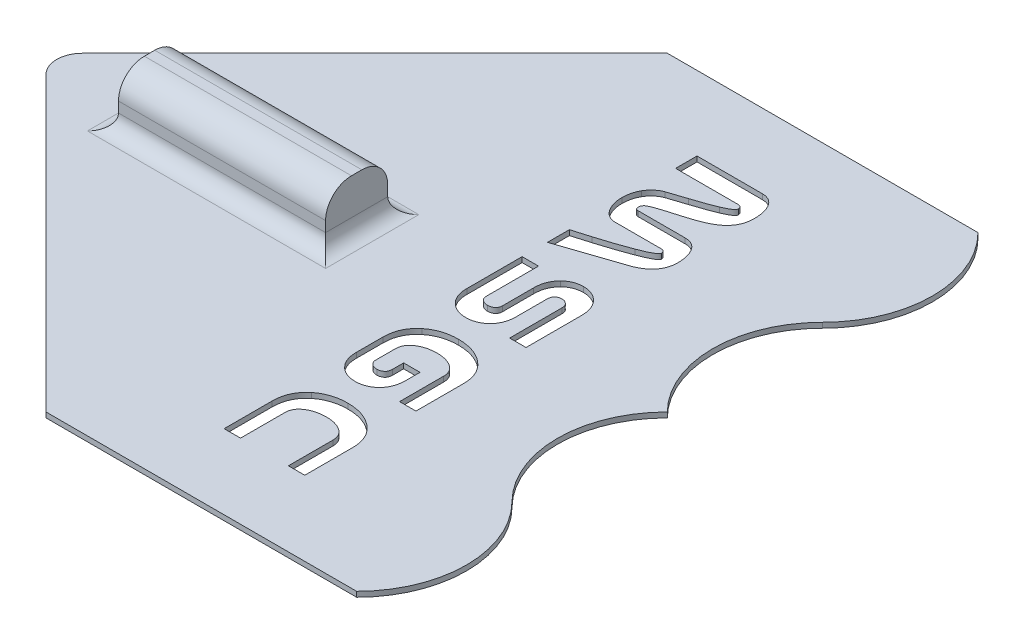
from build123d import *

# Parameters (mm, degrees)
BOSS_EXTRUDE1_DEPTH = 1
SKETCH2_W           = 40
SKETCH2_H           = 12
BOSS_EXTRUDE2_DEPTH = 10
CUT_EXTRUDE1_DEPTH  = 35
FILLET1_R           = 5
FILLET2_R           = 3
CUT_EXTRUDE3_DEPTH  = 10.5
FILLET3_R           = 5


with BuildPart() as part:
    # Sketch1 → Boss-Extrude1 (new body)
    with BuildSketch(Plane(origin=(0, 0, 0), x_dir=(1, 0, 0), z_dir=(0, 1, 0))):
        with BuildLine():
            Line((0, 0), (60, 60))
            Line((60, 60), (120, 60))
            ThreePointArc((120, 60), (126.213203436, 45), (120, 30))
            ThreePointArc((120, 30), (113.786796564, 15), (120, 0))
            ThreePointArc((120, 0), (113.786796564, -15), (120, -30))
            ThreePointArc((120, -30), (126.213203436, -45), (120, -60))
            Line((120, -60), (60, -60))
            Line((60, -60), (0, 0))
        make_face()
    extrude(amount=BOSS_EXTRUDE1_DEPTH)

    # Sketch2 → Boss-Extrude2 (add)
    with BuildSketch(Plane(origin=(0, 1, 0), x_dir=(1, 0, 0), z_dir=(0, 1, 0))):
        with Locations((40, 0)):
            Rectangle(SKETCH2_W, SKETCH2_H)
    extrude(amount=BOSS_EXTRUDE2_DEPTH)

    # Sketch3 → Cut-Extrude1 (cut)
    with BuildSketch(Plane.ZY.offset(-20)):
        Polygon((0, 1.110912703), (3.889087297, 5), (0, 8.889087297), (-3.889087297, 5), align=None)
    extrude(amount=-CUT_EXTRUDE1_DEPTH, mode=Mode.SUBTRACT)

    # Fillet1
    fillet1_edges = [part.edges().sort_by_distance(p)[0] for p in [
        (40, 11, -6),
        (40, 11, 6),
    ]]
    fillet(fillet1_edges, radius=FILLET1_R)

    # Fillet2
    # the kernel refuses this fillet: 3 mm, written as the material it adds along each edge
    with BuildSketch(Plane(origin=(20, 1, 6), x_dir=(0, 0, 1), z_dir=(1, 0, 0))) as fillet2_piece_1:
        with BuildLine():
            CenterArc((FILLET2_R, -FILLET2_R), FILLET2_R, 90, 90)
            Line((0, -FILLET2_R), (0, 0))
            Line((0, 0), (FILLET2_R, 0))
        make_face()
    extrude(amount=40)
    with BuildSketch(Plane(origin=(60, 1, 6), x_dir=(1, 0, 0), z_dir=(0, 0, -1))) as fillet2_piece_2:
        with BuildLine():
            CenterArc((FILLET2_R, -FILLET2_R), FILLET2_R, 90, 90)
            Line((0, -FILLET2_R), (0, 0))
            Line((0, 0), (FILLET2_R, 0))
        make_face()
    extrude(amount=12)
    with BuildSketch(Plane(origin=(20, 1, -6), x_dir=(0, 1, 0), z_dir=(0, 0, 1))) as fillet2_piece_3_section:
        with BuildLine():
            CenterArc((FILLET2_R, FILLET2_R), FILLET2_R, 180, 90)
            Line((0, FILLET2_R), (0, 0))
            Line((0, 0), (FILLET2_R, 0))
        make_face()
    fillet2_piece_3 = extrude(amount=12, mode=Mode.PRIVATE)
    fillet2_piece_3 = split(fillet2_piece_3, bisect_by=Plane(origin=(19.279830893, 2.992442475, -1.881529772), z_dir=(0, -0.7071067811865477, -0.7071067811865475)), keep=Keep.TOP, mode=Mode.PRIVATE)
    fillet2_piece_3 = split(fillet2_piece_3, bisect_by=Plane(origin=(19.279830893, -0.275222793, -1.386135496), z_dir=(0, 0.7071067811865475, -0.7071067811865477)), keep=Keep.TOP, mode=Mode.PRIVATE)
    add(fillet2_piece_3)
    with BuildSketch(Plane(origin=(20, 1, -6), x_dir=(0, 1, 0), z_dir=(0, 0, 1))) as fillet2_piece_4_section:
        with BuildLine():
            CenterArc((FILLET2_R, FILLET2_R), FILLET2_R, 180, 90)
            Line((0, FILLET2_R), (0, 0))
            Line((0, 0), (FILLET2_R, 0))
        make_face()
    fillet2_piece_4 = extrude(amount=12, mode=Mode.PRIVATE)
    fillet2_piece_4 = split(fillet2_piece_4, bisect_by=Plane(origin=(18.610952236, 1.052340199, 0.058572505), z_dir=(0, -0.7071067811865477, -0.7071067811865475)), keep=Keep.TOP, mode=Mode.PRIVATE)
    fillet2_piece_4 = split(fillet2_piece_4, bisect_by=Plane(origin=(18.610952236, 1.052340199, -0.058572505), z_dir=(0, -0.7071067811865475, 0.7071067811865477)), keep=Keep.TOP, mode=Mode.PRIVATE)
    add(fillet2_piece_4)
    with BuildSketch(Plane(origin=(20, 1, -6), x_dir=(0, 1, 0), z_dir=(0, 0, 1))) as fillet2_piece_5_section:
        with BuildLine():
            CenterArc((FILLET2_R, FILLET2_R), FILLET2_R, 180, 90)
            Line((0, FILLET2_R), (0, 0))
            Line((0, 0), (FILLET2_R, 0))
        make_face()
    fillet2_piece_5 = extrude(amount=12, mode=Mode.PRIVATE)
    fillet2_piece_5 = split(fillet2_piece_5, bisect_by=Plane(origin=(19.279830893, -0.275222793, 1.386135496), z_dir=(0, 0.7071067811865477, 0.7071067811865475)), keep=Keep.TOP, mode=Mode.PRIVATE)
    fillet2_piece_5 = split(fillet2_piece_5, bisect_by=Plane(origin=(19.279830893, 2.992442475, 1.881529772), z_dir=(0, -0.7071067811865475, 0.7071067811865477)), keep=Keep.TOP, mode=Mode.PRIVATE)
    add(fillet2_piece_5)
    with BuildSketch(Plane(origin=(60, 1, -6), x_dir=(0, 1, 0), z_dir=(-1, 0, 0))) as fillet2_piece_6:
        with BuildLine():
            CenterArc((FILLET2_R, FILLET2_R), FILLET2_R, 180, 90)
            Line((0, FILLET2_R), (0, 0))
            Line((0, 0), (FILLET2_R, 0))
        make_face()
    extrude(amount=40)
    with BuildSketch(Plane(origin=(20, 1, -6), x_dir=(0, 1, 0), z_dir=(0, 0, 1))) as fillet2_piece_7a_section:
        with BuildLine():
            CenterArc((FILLET2_R, FILLET2_R), FILLET2_R, 180, 90)
            Line((0, FILLET2_R), (0, 0))
            Line((0, 0), (FILLET2_R, 0))
        make_face()
    fillet2_piece_7a = extrude(amount=19.5, mode=Mode.PRIVATE)
    fillet2_piece_7a = split(fillet2_piece_7a, bisect_by=Plane(origin=(19.320814657, 1.679185343, 6), z_dir=(0, 0, 1)), keep=Keep.TOP, mode=Mode.PRIVATE)
    with BuildSketch(Plane(origin=(12.5, 1, 6), x_dir=(0, 0, 1), z_dir=(1, 0, 0))) as fillet2_piece_7b_section:
        with BuildLine():
            CenterArc((FILLET2_R, -FILLET2_R), FILLET2_R, 90, 90)
            Line((0, -FILLET2_R), (0, 0))
            Line((0, 0), (FILLET2_R, 0))
        make_face()
    fillet2_piece_7b = extrude(amount=47.5, mode=Mode.PRIVATE)
    fillet2_piece_7b = split(fillet2_piece_7b, bisect_by=Plane(origin=(20, 1.679185343, 6.679185343), z_dir=(-1, 0, 0)), keep=Keep.TOP, mode=Mode.PRIVATE)
    fillet2_piece_7 = fillet2_piece_7a & fillet2_piece_7b
    add(fillet2_piece_7)
    with BuildSketch(Plane(origin=(60, 1, 13.5), x_dir=(1, 0, 0), z_dir=(0, 0, -1))) as fillet2_piece_8a_section:
        with BuildLine():
            CenterArc((FILLET2_R, -FILLET2_R), FILLET2_R, 90, 90)
            Line((0, -FILLET2_R), (0, 0))
            Line((0, 0), (FILLET2_R, 0))
        make_face()
    fillet2_piece_8a = extrude(amount=19.5, mode=Mode.PRIVATE)
    fillet2_piece_8a = split(fillet2_piece_8a, bisect_by=Plane(origin=(60.679185343, 1.679185343, 6), z_dir=(0, 0, 1)), keep=Keep.TOP, mode=Mode.PRIVATE)
    with BuildSketch(Plane(origin=(20, 1, 6), x_dir=(0, 0, 1), z_dir=(1, 0, 0))) as fillet2_piece_8b_section:
        with BuildLine():
            CenterArc((FILLET2_R, -FILLET2_R), FILLET2_R, 90, 90)
            Line((0, -FILLET2_R), (0, 0))
            Line((0, 0), (FILLET2_R, 0))
        make_face()
    fillet2_piece_8b = extrude(amount=47.5, mode=Mode.PRIVATE)
    fillet2_piece_8b = split(fillet2_piece_8b, bisect_by=Plane(origin=(60, 1.679185343, 6.679185343), z_dir=(1, 0, 0)), keep=Keep.TOP, mode=Mode.PRIVATE)
    fillet2_piece_8 = fillet2_piece_8a & fillet2_piece_8b
    add(fillet2_piece_8)
    with BuildSketch(Plane(origin=(67.5, 1, -6), x_dir=(0, 1, 0), z_dir=(-1, 0, 0))) as fillet2_piece_9a_section:
        with BuildLine():
            CenterArc((FILLET2_R, FILLET2_R), FILLET2_R, 180, 90)
            Line((0, FILLET2_R), (0, 0))
            Line((0, 0), (FILLET2_R, 0))
        make_face()
    fillet2_piece_9a = extrude(amount=47.5, mode=Mode.PRIVATE)
    fillet2_piece_9a = split(fillet2_piece_9a, bisect_by=Plane(origin=(60, 1.679185343, -6.679185343), z_dir=(1, 0, 0)), keep=Keep.TOP, mode=Mode.PRIVATE)
    with BuildSketch(Plane(origin=(60, 1, 6), x_dir=(1, 0, 0), z_dir=(0, 0, -1))) as fillet2_piece_9b_section:
        with BuildLine():
            CenterArc((FILLET2_R, -FILLET2_R), FILLET2_R, 90, 90)
            Line((0, -FILLET2_R), (0, 0))
            Line((0, 0), (FILLET2_R, 0))
        make_face()
    fillet2_piece_9b = extrude(amount=19.5, mode=Mode.PRIVATE)
    fillet2_piece_9b = split(fillet2_piece_9b, bisect_by=Plane(origin=(60.679185343, 1.679185343, -6), z_dir=(0, 0, -1)), keep=Keep.TOP, mode=Mode.PRIVATE)
    fillet2_piece_9 = fillet2_piece_9a & fillet2_piece_9b
    add(fillet2_piece_9)
    with BuildSketch(Plane(origin=(20, 1, -13.5), x_dir=(0, 1, 0), z_dir=(0, 0, 1))) as fillet2_piece_10a_section:
        with BuildLine():
            CenterArc((FILLET2_R, FILLET2_R), FILLET2_R, 180, 90)
            Line((0, FILLET2_R), (0, 0))
            Line((0, 0), (FILLET2_R, 0))
        make_face()
    fillet2_piece_10a = extrude(amount=19.5, mode=Mode.PRIVATE)
    fillet2_piece_10a = split(fillet2_piece_10a, bisect_by=Plane(origin=(19.320814657, 1.679185343, -6), z_dir=(0, 0, -1)), keep=Keep.TOP, mode=Mode.PRIVATE)
    with BuildSketch(Plane(origin=(60, 1, -6), x_dir=(0, 1, 0), z_dir=(-1, 0, 0))) as fillet2_piece_10b_section:
        with BuildLine():
            CenterArc((FILLET2_R, FILLET2_R), FILLET2_R, 180, 90)
            Line((0, FILLET2_R), (0, 0))
            Line((0, 0), (FILLET2_R, 0))
        make_face()
    fillet2_piece_10b = extrude(amount=47.5, mode=Mode.PRIVATE)
    fillet2_piece_10b = split(fillet2_piece_10b, bisect_by=Plane(origin=(20, 1.679185343, -6.679185343), z_dir=(-1, 0, 0)), keep=Keep.TOP, mode=Mode.PRIVATE)
    fillet2_piece_10 = fillet2_piece_10a & fillet2_piece_10b
    add(fillet2_piece_10)

    # Sketch4 → Cut-Extrude3 (cut)
    with BuildSketch(Plane(origin=(0, 1, 0), x_dir=(1, 0, 0), z_dir=(0, 1, 0))):
        with BuildLine():
            Line((80.053235809, 16.783729557), (80.053235809, 21.031186604))
            add(Edge.make_bspline(
                [(80.053235809, 21.031186604), (80.613393213, 21.197523279), (81.733363954, 21.530094457), (82.854367375, 21.859167975), (83.414696892, 22.023654187)],
                knots=[0, 0, 0, 0, 1.000307211, 2, 2, 2, 2], degree=3))
            add(Edge.make_bspline(
                [(83.414696892, 22.023654187), (83.731764482, 22.120650481), (84.350136079, 22.309820724), (85.250563897, 22.596283331), (86.103088806, 22.869033297), (86.904677697, 23.133867718), (87.654959408, 23.395187581), (88.357567572, 23.63901705), (89.009146974, 23.880744981), (89.426623539, 24.038794418), (89.628076315, 24.115060969)],
                knots=[0, 0, 0, 0, 1.21356098, 2.366787608, 3.458327339, 4.489656438, 5.45648934, 6.366171503, 7.211598176, 8, 8, 8, 8], degree=3))
            add(Edge.make_bspline(
                [(89.628076315, 24.115060969), (89.88840437, 24.217819576), (90.376935768, 24.410656288), (91.052385994, 24.697500308), (91.623584261, 24.962595786), (92.084772063, 25.20755176), (92.449303244, 25.425494937), (92.697699025, 25.626620609), (92.870140497, 25.806735202), (92.889965345, 25.9383507), (92.898276011, 25.993524516)],
                knots=[0, 0, 0, 0, 1.740115658, 3.265499514, 4.562941408, 5.652408808, 6.516224318, 7.18830621, 7.659734268, 8, 8, 8, 8], degree=3))
            add(Edge.make_bspline(
                [(92.898276011, 25.993524516), (92.884946427, 26.057453848), (92.860207762, 26.176101691), (92.798174796, 26.334694443), (92.72548903, 26.464091954), (92.59597813, 26.585221845), (92.382836, 26.685877273), (92.194935735, 26.693065151), (92.09213376, 26.696997706)],
                knots=[0, 0, 0, 0, 0.981276588, 1.821172606, 2.557562909, 3.191931761, 4.463679864, 6, 6, 6, 6], degree=3))
            Line((92.09213376, 26.696997706), (83.228371561, 26.696997706))
            add(Edge.make_bspline(
                [(83.228371561, 26.696997706), (83.103843733, 26.701307529), (82.85792794, 26.709818507), (82.496705671, 26.779987744), (82.15239544, 26.898022665), (81.826780277, 27.066483724), (81.511543712, 27.269137513), (81.221398675, 27.53173652), (80.94342914, 27.833756409), (80.779691945, 28.062759202), (80.695868075, 28.179995243)],
                knots=[0, 0, 0, 0, 0.974842056, 1.925104307, 2.870217456, 3.816008348, 4.790850405, 5.796797676, 6.872089227, 8, 8, 8, 8], degree=3))
            add(Edge.make_bspline(
                [(80.695868075, 28.179995243), (80.620171486, 28.297884752), (80.469076719, 28.533199028), (80.281269105, 28.909232071), (80.113923752, 29.297171185), (79.986828377, 29.707251078), (79.885188387, 30.131670674), (79.80630197, 30.571831855), (79.766383864, 31.029894966), (79.759925472, 31.341123652), (79.756636302, 31.49962819)],
                knots=[0, 0, 0, 0, 0.959487051, 1.915191616, 2.87676054, 3.85204348, 4.852835307, 5.866810799, 6.913595738, 8, 8, 8, 8], degree=3))
            add(Edge.make_bspline(
                [(79.756636302, 31.49962819), (79.764124791, 31.771675331), (79.778828897, 32.305856536), (79.932404403, 33.080900817), (80.157303034, 33.821009668), (80.392067317, 34.273447559), (80.509542743, 34.499846284)],
                knots=[0, 0, 0, 0, 1.042757589, 2.047518324, 3.022983328, 4, 4, 4, 4], degree=3))
            add(Edge.make_bspline(
                [(80.509542743, 34.499846284), (80.582677792, 34.620032867), (80.726985871, 34.857181749), (80.969884522, 35.191321305), (81.244034823, 35.490070711), (81.530755391, 35.772485858), (81.850403025, 36.016481574), (82.184491291, 36.245284475), (82.546842358, 36.437924263), (82.800371155, 36.544978783), (82.927969495, 36.598858182)],
                knots=[0, 0, 0, 0, 1.033555521, 2.039383499, 3.028561361, 4.009949086, 4.991734412, 5.978410299, 6.98255546, 8, 8, 8, 8], degree=3))
            add(Edge.make_bspline(
                [(82.927969495, 36.598858182), (82.968443399, 36.614310498), (83.078950103, 36.656500265), (83.290475167, 36.72568018), (83.58860471, 36.824945371), (83.972286557, 36.956728382), (84.447294813, 37.104552081), (85.00795555, 37.289697971), (85.654947069, 37.50229601), (86.116934904, 37.649980172), (86.361679176, 37.728217844)],
                knots=[0, 0, 0, 0, 0.28760656, 0.785257906, 1.477169671, 2.373997714, 3.478475492, 4.779826338, 6.294069669, 8, 8, 8, 8], degree=3))
            add(Edge.make_bspline(
                [(86.361679176, 37.728217844), (86.591259217, 37.802520801), (87.037067184, 37.946805341), (87.685421824, 38.165433973), (88.295900893, 38.372321296), (88.868002494, 38.576198307), (89.403529099, 38.766401792), (89.896914154, 38.959914974), (90.355502742, 39.135557055), (90.644954268, 39.258571056), (90.784053882, 39.317686999)],
                knots=[0, 0, 0, 0, 1.23196185, 2.392274201, 3.493269489, 4.522774996, 5.493080853, 6.394427912, 7.228421907, 8, 8, 8, 8], degree=3))
            add(Edge.make_bspline(
                [(90.784053882, 39.317686999), (90.954262665, 39.394199593), (91.273890376, 39.537879284), (91.717066146, 39.751473862), (92.087358686, 39.960965152), (92.387997402, 40.156414563), (92.62332476, 40.338430383), (92.78650122, 40.511440619), (92.890043809, 40.680315528), (92.895711226, 40.794597163), (92.898276011, 40.846315229)],
                knots=[0, 0, 0, 0, 1.657149667, 3.111889682, 4.366958607, 5.431474911, 6.296314017, 6.997410855, 7.546279055, 8, 8, 8, 8], degree=3))
            add(Edge.make_bspline(
                [(92.898276011, 40.846315229), (92.884537916, 40.906269242), (92.858598564, 41.019470393), (92.800124334, 41.172558263), (92.721753121, 41.293818626), (92.601815457, 41.422037193), (92.387565395, 41.527802354), (92.198706901, 41.537115433), (92.095936318, 41.542183304)],
                knots=[0, 0, 0, 0, 0.939222653, 1.773377314, 2.487687195, 3.131320834, 4.438959131, 6, 6, 6, 6], degree=3))
            Line((92.095936318, 41.542183304), (80.053235809, 41.542183304))
            Line((80.053235809, 41.542183304), (80.053235809, 45.679366175))
            Line((80.053235809, 45.679366175), (92.666319986, 45.679366175))
            add(Edge.make_bspline(
                [(92.666319986, 45.679366175), (92.806144682, 45.675928622), (93.07914356, 45.669217016), (93.47389538, 45.589264484), (93.843070493, 45.466981111), (94.190084386, 45.299986313), (94.507777468, 45.075801248), (94.797379056, 44.802904445), (95.063689373, 44.483907942), (95.21307931, 44.243988159), (95.290084859, 44.120317483)],
                knots=[0, 0, 0, 0, 1.043606644, 2.037575981, 2.996201597, 3.945230365, 4.904464291, 5.889727954, 6.912224887, 8, 8, 8, 8], degree=3))
            add(Edge.make_bspline(
                [(95.290084859, 44.120317483), (95.352982716, 44.004711416), (95.479711934, 43.771783505), (95.634754616, 43.397930317), (95.768468201, 43.003214136), (95.873954296, 42.581944608), (95.956761171, 42.138644505), (96.017242243, 41.671510601), (96.056817791, 41.18162588), (96.060250887, 40.846394837), (96.062004089, 40.675200129)],
                knots=[0, 0, 0, 0, 0.884238256, 1.781599998, 2.716646166, 3.683870324, 4.698325051, 5.746816069, 6.849351298, 8, 8, 8, 8], degree=3))
            add(Edge.make_bspline(
                [(96.062004089, 40.675200129), (96.055093817, 40.446526059), (96.041528785, 39.997633355), (95.923175412, 39.344150862), (95.738524425, 38.725852705), (95.472403794, 38.145727111), (95.130693004, 37.601535286), (94.712632136, 37.093628583), (94.219752335, 36.622153765), (93.845963987, 36.350031965), (93.654985011, 36.210997287)],
                knots=[0, 0, 0, 0, 1.035935017, 2.033565387, 3.000623989, 3.954619206, 4.917623108, 5.905758593, 6.929993187, 8, 8, 8, 8], degree=3))
            add(Edge.make_bspline(
                [(93.654985011, 36.210997287), (93.511691577, 36.116495393), (93.211092911, 35.918250835), (92.713665484, 35.64760951), (92.156890218, 35.376819601), (91.536726715, 35.112767977), (90.855534293, 34.850578417), (90.11148545, 34.593507958), (89.307604522, 34.333241656), (88.746446927, 34.174753037), (88.456888517, 34.0929726)],
                knots=[0, 0, 0, 0, 0.730704929, 1.532861074, 2.409191789, 3.366741913, 4.402255391, 5.516997667, 6.718765965, 8, 8, 8, 8], degree=3))
            add(Edge.make_bspline(
                [(88.456888517, 34.0929726), (88.14378267, 34.003089236), (87.548859176, 33.832304417), (86.701964748, 33.587355017), (85.951614167, 33.353591175), (85.291811895, 33.147765826), (84.728320797, 32.952834924), (84.257365423, 32.779523911), (83.877790565, 32.626589941), (83.661382227, 32.519769657), (83.566799204, 32.473082983)],
                knots=[0, 0, 0, 0, 1.516031487, 2.880568209, 4.102725104, 5.173568294, 6.096988055, 6.877162184, 7.509254603, 8, 8, 8, 8], degree=3))
            add(Edge.make_bspline(
                [(83.566799204, 32.473082983), (83.472297313, 32.416229882), (83.283528745, 32.302665187), (83.082873095, 32.039992392), (82.944669938, 31.747883273), (82.928353458, 31.537832424), (82.92036438, 31.434984708)],
                knots=[0, 0, 0, 0, 1.023198663, 2.043850597, 3.042205737, 4, 4, 4, 4], degree=3))
            add(Edge.make_bspline(
                [(82.92036438, 31.434984708), (82.926402464, 31.351187318), (82.9379202, 31.191342523), (83.041967897, 31.012325413), (83.167408291, 30.920598132), (83.281440534, 30.870292989), (83.41701797, 30.840460649), (83.514671276, 30.836366212), (83.566799204, 30.834180578)],
                knots=[0, 0, 0, 0, 1.493295585, 2.848484008, 3.529682974, 4.251311034, 5.066539215, 6, 6, 6, 6], degree=3))
            Line((83.566799204, 30.834180578), (92.59026883, 30.834180578))
            add(Edge.make_bspline(
                [(92.59026883, 30.834180578), (92.732515783, 30.830186496), (93.011339079, 30.822357556), (93.416086404, 30.749717753), (93.793171553, 30.624982705), (94.147875579, 30.460379567), (94.467203579, 30.232869882), (94.769434758, 29.969938919), (95.03951279, 29.651583719), (95.192671353, 29.412650324), (95.27107207, 29.290342116)],
                knots=[0, 0, 0, 0, 1.049564227, 2.057288055, 3.021992928, 3.976293905, 4.93151204, 5.906015706, 6.928105193, 8, 8, 8, 8], degree=3))
            add(Edge.make_bspline(
                [(95.27107207, 29.290342116), (95.335230684, 29.176032625), (95.464436685, 28.945830142), (95.623354508, 28.575762215), (95.761013161, 28.184865588), (95.869386519, 27.76845954), (95.958698217, 27.329550681), (96.01630341, 26.866763257), (96.057127733, 26.380848854), (96.060351343, 26.049387946), (96.062004089, 25.879447782)],
                knots=[0, 0, 0, 0, 0.887356727, 1.787005784, 2.723783732, 3.692172301, 4.699072598, 5.755488419, 6.849237848, 8, 8, 8, 8], degree=3))
            add(Edge.make_bspline(
                [(96.062004089, 25.879447782), (96.059128832, 25.739901437), (96.053467015, 25.465113597), (96.007004412, 25.057882934), (95.927281273, 24.663739324), (95.816175567, 24.281077065), (95.676007136, 23.911750988), (95.502355179, 23.554667711), (95.29906593, 23.208793434), (95.138696548, 22.991964555), (95.058128834, 22.883032246)],
                knots=[0, 0, 0, 0, 1.039956352, 2.047831207, 3.050244489, 4.033961433, 5.014815888, 5.990926599, 6.990664873, 8, 8, 8, 8], degree=3))
            add(Edge.make_bspline(
                [(95.058128834, 22.883032246), (94.965229094, 22.768287379), (94.778071355, 22.537119992), (94.454036287, 22.222055215), (94.101122746, 21.92533491), (93.715434912, 21.651359625), (93.297373437, 21.39827619), (92.844873027, 21.169102388), (92.362415431, 20.953768936), (92.024576609, 20.833728766), (91.85257262, 20.772612675)],
                knots=[0, 0, 0, 0, 0.909452944, 1.832202737, 2.780665515, 3.749887927, 4.74558583, 5.790505111, 6.875079148, 8, 8, 8, 8], degree=3))
            Line((91.85257262, 20.772612675), (80.053235809, 16.783729557))
        make_face()
        with BuildLine():
            Line((92.411548615, -2.864847036), (92.411548615, 7.257561791))
            add(Edge.make_bspline(
                [(92.411548615, 7.257561791), (92.407166925, 7.365883693), (92.398720409, 7.574694195), (92.313281264, 7.870116894), (92.168932793, 8.129171252), (91.96879003, 8.344560455), (91.734885731, 8.516609395), (91.47917611, 8.647928326), (91.199861918, 8.720076055), (91.007517877, 8.731127295), (90.909538289, 8.73675677)],
                knots=[0, 0, 0, 0, 1.100485494, 2.121389342, 3.097694131, 4.093249951, 5.089390924, 6.041521729, 7.002355921, 8, 8, 8, 8], degree=3))
            add(Edge.make_bspline(
                [(90.909538289, 8.73675677), (90.81387451, 8.733232432), (90.628440252, 8.726400872), (90.362647785, 8.647810386), (90.116019529, 8.532103026), (89.899394391, 8.361434919), (89.711965613, 8.153233103), (89.581452604, 7.893665648), (89.505260018, 7.593959116), (89.496035966, 7.380988987), (89.491184235, 7.268969464)],
                knots=[0, 0, 0, 0, 0.996486041, 1.931584246, 2.873411208, 3.827083187, 4.793907364, 5.777191984, 6.830831839, 8, 8, 8, 8], degree=3))
            Line((89.491184235, 7.268969464), (89.491184235, 1.355992107))
            add(Edge.make_bspline(
                [(89.491184235, 1.355992107), (89.486900901, 1.161878913), (89.478530181, 0.782532572), (89.410306058, 0.22819176), (89.29117588, -0.29299087), (89.133404812, -0.785460313), (88.921275962, -1.242588676), (88.669969513, -1.672884512), (88.369797974, -2.071343859), (88.134078548, -2.305998114), (88.015791814, -2.423750333)],
                knots=[0, 0, 0, 0, 1.115035032, 2.17906084, 3.201946138, 4.182965951, 5.144245686, 6.090933411, 7.042008307, 8, 8, 8, 8], degree=3))
            add(Edge.make_bspline(
                [(88.015791814, -2.423750333), (87.903389104, -2.523356791), (87.681440268, -2.720038326), (87.321548238, -2.978115566), (86.937894853, -3.189552869), (86.538780696, -3.370808318), (86.117915048, -3.508357701), (85.676507798, -3.600881862), (85.217736596, -3.665484328), (84.904261693, -3.671663947), (84.745592117, -3.674791845)],
                knots=[0, 0, 0, 0, 1.003646545, 1.981786603, 2.952964984, 3.92775933, 4.908501852, 5.905724936, 6.939954255, 8, 8, 8, 8], degree=3))
            add(Edge.make_bspline(
                [(84.745592117, -3.674791845), (84.586998719, -3.671164013), (84.275093419, -3.664029164), (83.816353741, -3.60696388), (83.379265426, -3.506858945), (82.95836419, -3.373290468), (82.556775318, -3.199147443), (82.174299753, -2.983824433), (81.810023163, -2.733155822), (81.587609248, -2.537617544), (81.475392421, -2.438960564)],
                knots=[0, 0, 0, 0, 1.062359459, 2.089340097, 3.090578133, 4.062764217, 5.044031864, 6.017329992, 6.999662698, 8, 8, 8, 8], degree=3))
            add(Edge.make_bspline(
                [(81.475392421, -2.438960564), (81.357470307, -2.320924378), (81.123900013, -2.08712814), (80.819948199, -1.695598441), (80.570159375, -1.269112563), (80.3577423, -0.816010286), (80.199984467, -0.32725415), (80.081270016, 0.188914034), (80.012413335, 0.738123699), (80.004211514, 1.113703926), (80, 1.306558855)],
                knots=[0, 0, 0, 0, 0.965253394, 1.911893473, 2.859443072, 3.821344106, 4.802831145, 5.826314837, 6.883844599, 8, 8, 8, 8], degree=3))
            Line((80, 1.306558855), (80, 11.953720657))
            Line((80, 11.953720657), (83.163728078, 11.953720657))
            Line((83.163728078, 11.953720657), (83.163728078, 1.854127177))
            add(Edge.make_bspline(
                [(83.163728078, 1.854127177), (83.169180004, 1.750803876), (83.179715492, 1.551138374), (83.272571914, 1.267909508), (83.436602364, 1.026780963), (83.648784299, 0.821329319), (83.906244201, 0.665149388), (84.182248871, 0.546071376), (84.479664296, 0.474518514), (84.683093721, 0.466502137), (84.787420253, 0.462391027)],
                knots=[0, 0, 0, 0, 1.036668043, 2.003293017, 2.94999418, 3.940817523, 4.947960164, 5.958078123, 6.952822945, 8, 8, 8, 8], degree=3))
            add(Edge.make_bspline(
                [(84.787420253, 0.462391027), (84.890436181, 0.466835486), (85.090989649, 0.475488047), (85.380662096, 0.541184617), (85.646687271, 0.651841794), (85.883259131, 0.808474224), (86.086328906, 1.005231327), (86.229667402, 1.253718843), (86.314960693, 1.54187668), (86.323170849, 1.747041175), (86.327456156, 1.854127177)],
                knots=[0, 0, 0, 0, 1.055868443, 2.05558579, 3.028575215, 3.994854589, 4.950848023, 5.900634217, 6.904232011, 8, 8, 8, 8], degree=3))
            Line((86.327456156, 1.854127177), (86.327456156, 7.789919881))
            add(Edge.make_bspline(
                [(86.327456156, 7.789919881), (86.331586263, 7.98534209), (86.339685178, 8.368554465), (86.41019941, 8.925548488), (86.518281046, 9.45373443), (86.679037314, 9.947340694), (86.881733422, 10.412900855), (87.128171475, 10.845520647), (87.419920094, 11.249157805), (87.649024541, 11.487314218), (87.764823, 11.607687898)],
                knots=[0, 0, 0, 0, 1.118158643, 2.192648578, 3.208644886, 4.19983211, 5.158241474, 6.110341366, 7.044891711, 8, 8, 8, 8], degree=3))
            add(Edge.make_bspline(
                [(87.764823, 11.607687898), (87.873222145, 11.708742916), (88.087753804, 11.908739887), (88.43941153, 12.167812612), (88.811714879, 12.386531038), (89.202836411, 12.565221964), (89.613556781, 12.70270777), (90.042623195, 12.801316838), (90.490654971, 12.864297495), (90.796518199, 12.870698851), (90.951366425, 12.873939641)],
                knots=[0, 0, 0, 0, 1.009439192, 1.997770973, 2.969731579, 3.947815796, 4.923110885, 5.916414109, 6.945150807, 8, 8, 8, 8], degree=3))
            add(Edge.make_bspline(
                [(90.951366425, 12.873939641), (91.104968219, 12.87081119), (91.407092035, 12.864657748), (91.851057161, 12.800308638), (92.276818697, 12.703644525), (92.683855983, 12.564398116), (93.074566363, 12.389380358), (93.446313895, 12.172288386), (93.801216777, 11.915553851), (94.01689892, 11.716464372), (94.126502176, 11.615293014)],
                knots=[0, 0, 0, 0, 1.051022544, 2.067286666, 3.065151962, 4.036704709, 5.007792191, 5.991709147, 6.979446265, 8, 8, 8, 8], degree=3))
            add(Edge.make_bspline(
                [(94.126502176, 11.615293014), (94.241930227, 11.494647363), (94.472047971, 11.254127793), (94.769733793, 10.853025925), (95.016763702, 10.418597452), (95.225234737, 9.957742558), (95.378081277, 9.46378274), (95.493944595, 8.942717416), (95.562794745, 8.390028392), (95.571051616, 8.010661497), (95.575276693, 7.816537786)],
                knots=[0, 0, 0, 0, 0.95813203, 1.910135191, 2.858933461, 3.823320204, 4.808493239, 5.822129563, 6.885574103, 8, 8, 8, 8], degree=3))
            Line((95.575276693, 7.816537786), (95.575276693, -2.864847036))
            Line((95.575276693, -2.864847036), (92.411548615, -2.864847036))
        make_face()
        with BuildLine():
            Line((92.411548615, -24.129510689), (92.411548615, -15.600373574))
            add(Edge.make_bspline(
                [(92.411548615, -15.600373574), (92.407049449, -15.474620428), (92.398261633, -15.228998055), (92.332720667, -14.870444222), (92.220823859, -14.533578228), (92.068930539, -14.214847757), (91.86867772, -13.919082926), (91.621285172, -13.648804491), (91.33500124, -13.395223659), (91.119208205, -13.249279675), (91.008404791, -13.174341706)],
                knots=[0, 0, 0, 0, 1.027313501, 2.006559566, 2.96627352, 3.920606487, 4.882999653, 5.873086913, 6.907892316, 8, 8, 8, 8], degree=3))
            add(Edge.make_bspline(
                [(91.008404791, -13.174341706), (90.901742771, -13.11025834), (90.687108188, -12.981304223), (90.342614158, -12.822516117), (89.980707436, -12.690498577), (89.601111818, -12.579106311), (89.203539691, -12.49178603), (88.785319158, -12.432319636), (88.349925725, -12.392481126), (88.052641719, -12.388986443), (87.90171508, -12.387212245)],
                knots=[0, 0, 0, 0, 0.919125024, 1.849543216, 2.797991367, 3.764405536, 4.771378576, 5.803444258, 6.884841532, 8, 8, 8, 8], degree=3))
            add(Edge.make_bspline(
                [(87.90171508, -12.387212245), (87.745686787, -12.388566166), (87.439368532, -12.391224214), (86.988991181, -12.436973731), (86.55539868, -12.498834908), (86.138830965, -12.591261725), (85.739135619, -12.70764799), (85.358245187, -12.855031115), (84.989855377, -13.018374599), (84.76081422, -13.15548056), (84.646725615, -13.223774958)],
                knots=[0, 0, 0, 0, 1.099412945, 2.158392236, 3.188321445, 4.185638689, 5.163919944, 6.119826677, 7.063459363, 8, 8, 8, 8], degree=3))
            add(Edge.make_bspline(
                [(84.646725615, -13.223774958), (84.52974355, -13.301356747), (84.301787588, -13.452535746), (83.9963325, -13.71094078), (83.739527449, -13.989456867), (83.528803289, -14.288206135), (83.366379222, -14.607459137), (83.245841699, -14.945582364), (83.17646598, -15.303471011), (83.168024479, -15.548110201), (83.163728078, -15.672622172)],
                knots=[0, 0, 0, 0, 1.12168054, 2.185751874, 3.189934389, 4.143059825, 5.099412558, 6.0449648, 7.004962019, 8, 8, 8, 8], degree=3))
            Line((83.163728078, -15.672622172), (83.163728078, -17.364760387))
            Line((83.163728078, -17.364760387), (83.163728078, -19.482785074))
            add(Edge.make_bspline(
                [(83.163728078, -19.482785074), (83.169001225, -19.588694114), (83.179133896, -19.792204739), (83.273560082, -20.080740363), (83.434986496, -20.328693322), (83.648823898, -20.537779038), (83.905015697, -20.699303455), (84.182981471, -20.816042789), (84.479017781, -20.894130763), (84.682976406, -20.901280449), (84.787420253, -20.904941686)],
                knots=[0, 0, 0, 0, 1.051829546, 2.021154074, 2.97991524, 3.970028452, 4.974263488, 5.974688576, 6.962871427, 8, 8, 8, 8], degree=3))
            add(Edge.make_bspline(
                [(84.787420253, -20.904941686), (84.890621104, -20.901294381), (85.092127585, -20.894172776), (85.380265774, -20.816928785), (85.648091279, -20.704684659), (85.884741522, -20.539103225), (86.088063419, -20.330342224), (86.228734008, -20.068146497), (86.315792228, -19.765853092), (86.323429973, -19.550615409), (86.327456156, -19.43715438)],
                knots=[0, 0, 0, 0, 1.02997274, 2.011089838, 2.965201196, 3.922005412, 4.881830062, 5.852400752, 6.867908189, 8, 8, 8, 8], degree=3))
            Line((86.327456156, -19.43715438), (86.327456156, -17.254486211))
            Line((86.327456156, -17.254486211), (89.491184235, -17.254486211))
            Line((89.491184235, -17.254486211), (89.491184235, -20.003735491))
            add(Edge.make_bspline(
                [(89.491184235, -20.003735491), (89.486888923, -20.197844748), (89.478494796, -20.577183395), (89.410437928, -21.131579182), (89.290439974, -21.653740816), (89.134281113, -22.148020386), (88.921144849, -22.60605267), (88.670134435, -23.036555868), (88.368708597, -23.435104805), (88.13392903, -23.671921021), (88.015791814, -23.791083046)],
                knots=[0, 0, 0, 0, 1.113338047, 2.175744502, 3.197073058, 4.183511169, 5.143327921, 6.08857487, 7.038202314, 8, 8, 8, 8], degree=3))
            add(Edge.make_bspline(
                [(88.015791814, -23.791083046), (87.903389104, -23.890689503), (87.681440268, -24.087371039), (87.321548238, -24.345448278), (86.937894853, -24.556885581), (86.538780696, -24.738141031), (86.117915048, -24.875690414), (85.676507798, -24.968214575), (85.217736596, -25.03281704), (84.904261693, -25.038996659), (84.745592117, -25.042124557)],
                knots=[0, 0, 0, 0, 1.003646545, 1.981786603, 2.952964984, 3.92775933, 4.908501852, 5.905724936, 6.939954255, 8, 8, 8, 8], degree=3))
            add(Edge.make_bspline(
                [(84.745592117, -25.042124557), (84.586903219, -25.039094746), (84.274647602, -25.03313292), (83.817382592, -24.967529127), (83.377827859, -24.877006234), (82.959394734, -24.73497909), (82.555444453, -24.563967578), (82.17558184, -24.342564876), (81.808705023, -24.093282278), (81.587368845, -23.895132016), (81.475392421, -23.794885604)],
                knots=[0, 0, 0, 0, 1.060827031, 2.087412553, 3.085370621, 4.058780343, 5.038632535, 6.014698022, 6.995613737, 8, 8, 8, 8], degree=3))
            add(Edge.make_bspline(
                [(81.475392421, -23.794885604), (81.357258023, -23.677009751), (81.122555991, -23.442821382), (80.821250291, -23.048007704), (80.56899914, -22.620576038), (80.357849901, -22.164147641), (80.200573639, -21.67287587), (80.080786154, -21.154409082), (80.012511163, -20.602559321), (80.004244277, -20.224468084), (80, -20.030353395)],
                knots=[0, 0, 0, 0, 0.961161485, 1.9095755, 2.85310824, 3.817568646, 4.801834447, 5.82097938, 6.881275553, 8, 8, 8, 8], degree=3))
            Line((80, -20.030353395), (80, -17.292511789))
            Line((80, -17.292511789), (80, -14.957741308))
            add(Edge.make_bspline(
                [(80, -14.957741308), (80.00724511, -14.688639457), (80.021389038, -14.16329792), (80.133538396, -13.396915897), (80.319037846, -12.673231474), (80.582728308, -11.993282229), (80.919534389, -11.355334763), (81.333582052, -10.764469148), (81.818848402, -10.212925044), (82.193722799, -9.892194), (82.384203732, -9.729224352)],
                knots=[0, 0, 0, 0, 1.084148089, 2.116477539, 3.113851377, 4.089041089, 5.048789687, 6.013811929, 6.990779417, 8, 8, 8, 8], degree=3))
            add(Edge.make_bspline(
                [(82.384203732, -9.729224352), (82.565531727, -9.591316078), (82.927094012, -9.316331342), (83.51330371, -8.967503418), (84.127660651, -8.669707926), (84.773351832, -8.423621175), (85.452054806, -8.241146207), (86.159175317, -8.101282779), (86.898542351, -8.021722744), (87.402128901, -8.011743213), (87.658351382, -8.006665675)],
                knots=[0, 0, 0, 0, 0.965598034, 1.925371926, 2.887131185, 3.858637446, 4.851157086, 5.864368451, 6.913400659, 8, 8, 8, 8], degree=3))
            add(Edge.make_bspline(
                [(87.658351382, -8.006665675), (87.919702058, -8.011241263), (88.433653943, -8.020239259), (89.188662601, -8.1071668), (89.913479535, -8.242899169), (90.60993354, -8.432955122), (91.27620293, -8.681022984), (91.914410089, -8.98209824), (92.522350945, -9.339161986), (92.899400708, -9.619247001), (93.0884039, -9.759644814)],
                knots=[0, 0, 0, 0, 1.078280753, 2.120462948, 3.132104403, 4.119486806, 5.096083912, 6.062540134, 7.028812278, 8, 8, 8, 8], degree=3))
            add(Edge.make_bspline(
                [(93.0884039, -9.759644814), (93.286156148, -9.924049335), (93.674406229, -10.246827301), (94.184273877, -10.796718663), (94.615902989, -11.387496605), (94.969886607, -12.02029013), (95.240739136, -12.695652928), (95.433786614, -13.411586383), (95.555760248, -14.168978919), (95.568678426, -14.688553601), (95.575276693, -14.95393875)],
                knots=[0, 0, 0, 0, 1.031679156, 2.025511827, 3.001675887, 3.963070097, 4.928872052, 5.915276245, 6.935177668, 8, 8, 8, 8], degree=3))
            Line((95.575276693, -14.95393875), (95.575276693, -24.129510689))
            Line((95.575276693, -24.129510689), (92.411548615, -24.129510689))
        make_face()
        with BuildLine():
            Line((80, -45.595709904), (80, -36.363099599))
            add(Edge.make_bspline(
                [(80, -36.363099599), (80.007246869, -36.092732162), (80.02139554, -35.564871063), (80.133544892, -34.794711807), (80.319029792, -34.067250432), (80.582704841, -33.383521272), (80.919465112, -32.741780141), (81.333491651, -32.147114289), (81.818693264, -31.591743328), (82.19370314, -31.268411124), (82.384203732, -31.10416218)],
                knots=[0, 0, 0, 0, 1.084394541, 2.11715471, 3.115005547, 4.090591035, 5.050556954, 6.015453766, 6.991873931, 8, 8, 8, 8], degree=3))
            add(Edge.make_bspline(
                [(82.384203732, -31.10416218), (82.56535479, -30.964739908), (82.925972787, -30.687191539), (83.513453594, -30.338897174), (84.12753414, -30.040464501), (84.774031835, -29.795915649), (85.451353233, -29.607227458), (86.159278082, -29.468983219), (86.898515199, -29.388958297), (87.402119745, -29.379043162), (87.658351382, -29.373998388)],
                knots=[0, 0, 0, 0, 0.968220944, 1.927440559, 2.888644395, 3.859589603, 4.852975567, 5.865601794, 6.914028178, 8, 8, 8, 8], degree=3))
            add(Edge.make_bspline(
                [(87.658351382, -29.373998388), (87.919712145, -29.378539291), (88.433683865, -29.387469079), (89.188548971, -29.474890247), (89.914221619, -29.608888837), (90.609103949, -29.805573717), (91.27738052, -30.050832816), (91.913246895, -30.358162073), (92.523600204, -30.713516142), (92.899621325, -30.99637502), (93.0884039, -31.138385201)],
                knots=[0, 0, 0, 0, 1.077378462, 2.118688571, 3.129483498, 4.117437208, 5.09321711, 6.061111311, 7.02657489, 8, 8, 8, 8], degree=3))
            add(Edge.make_bspline(
                [(93.0884039, -31.138385201), (93.286599467, -31.302384383), (93.677156296, -31.625555084), (94.181700528, -32.182887901), (94.617263674, -32.77418402), (94.970689275, -33.411583457), (95.239976462, -34.092498148), (95.433910845, -34.813143469), (95.555720013, -35.574369852), (95.568665155, -36.096453309), (95.575276693, -36.363099599)],
                knots=[0, 0, 0, 0, 1.027007161, 2.023782193, 2.995525661, 3.956993988, 4.927825871, 5.914651469, 6.934939538, 8, 8, 8, 8], degree=3))
            Line((95.575276693, -36.363099599), (95.575276693, -45.595709904))
            Line((95.575276693, -45.595709904), (92.411548615, -45.595709904))
            Line((92.411548615, -45.595709904), (92.411548615, -36.994324191))
            add(Edge.make_bspline(
                [(92.411548615, -36.994324191), (92.407019038, -36.867313262), (92.398170356, -36.619193113), (92.333250156, -36.257971097), (92.220921288, -35.919841516), (92.067952374, -35.60057516), (91.868950454, -35.301636361), (91.621283667, -35.027792919), (91.336220414, -34.77002449), (91.119384918, -34.624011492), (91.008404791, -34.549279535)],
                knots=[0, 0, 0, 0, 1.032012605, 2.016071548, 2.970569114, 3.91971494, 4.885431547, 5.877813057, 6.913828312, 8, 8, 8, 8], degree=3))
            add(Edge.make_bspline(
                [(91.008404791, -34.549279535), (90.901771134, -34.485125602), (90.687193626, -34.356029485), (90.341860449, -34.198138557), (89.980881868, -34.061652309), (89.601731339, -33.945537064), (89.203465503, -33.859392356), (88.785340194, -33.799574764), (88.349920169, -33.759834332), (88.052639848, -33.756326056), (87.90171508, -33.754544957)],
                knots=[0, 0, 0, 0, 0.918441424, 1.848167617, 2.799187121, 3.767555761, 4.773779864, 5.805077947, 6.885670931, 8, 8, 8, 8], degree=3))
            add(Edge.make_bspline(
                [(87.90171508, -33.754544957), (87.745695106, -33.7559355), (87.439393181, -33.758665444), (86.988897876, -33.803895664), (86.555998078, -33.867603937), (86.138155349, -33.953203779), (85.740134579, -34.072689876), (85.35725018, -34.213441455), (84.990974365, -34.378927562), (84.761005515, -34.51304978), (84.646725615, -34.579699997)],
                knots=[0, 0, 0, 0, 1.100709269, 2.160937209, 3.192080813, 4.188688572, 5.168123325, 6.122015984, 7.066761313, 8, 8, 8, 8], degree=3))
            add(Edge.make_bspline(
                [(84.646725615, -34.579699997), (84.529745872, -34.655996218), (84.301908958, -34.804595413), (83.996735405, -35.059352236), (83.738198879, -35.334126308), (83.531103207, -35.631472503), (83.366213309, -35.943984402), (83.245330024, -36.275929953), (83.17653673, -36.628960691), (83.168048622, -36.871081804), (83.163728078, -36.994324191)],
                knots=[0, 0, 0, 0, 1.126769692, 2.194565673, 3.20097552, 4.163348014, 5.110807601, 6.046255243, 7.005521807, 8, 8, 8, 8], degree=3))
            Line((83.163728078, -36.994324191), (83.163728078, -45.595709904))
            Line((83.163728078, -45.595709904), (80, -45.595709904))
        make_face()
    extrude(amount=-CUT_EXTRUDE3_DEPTH, mode=Mode.SUBTRACT)

    # Fillet3
    fillet3_edges = [part.edges().sort_by_distance(p)[0] for p in [
        (0, 0.5, 0),
    ]]
    fillet(fillet3_edges, radius=FILLET3_R)


solid = part.part
